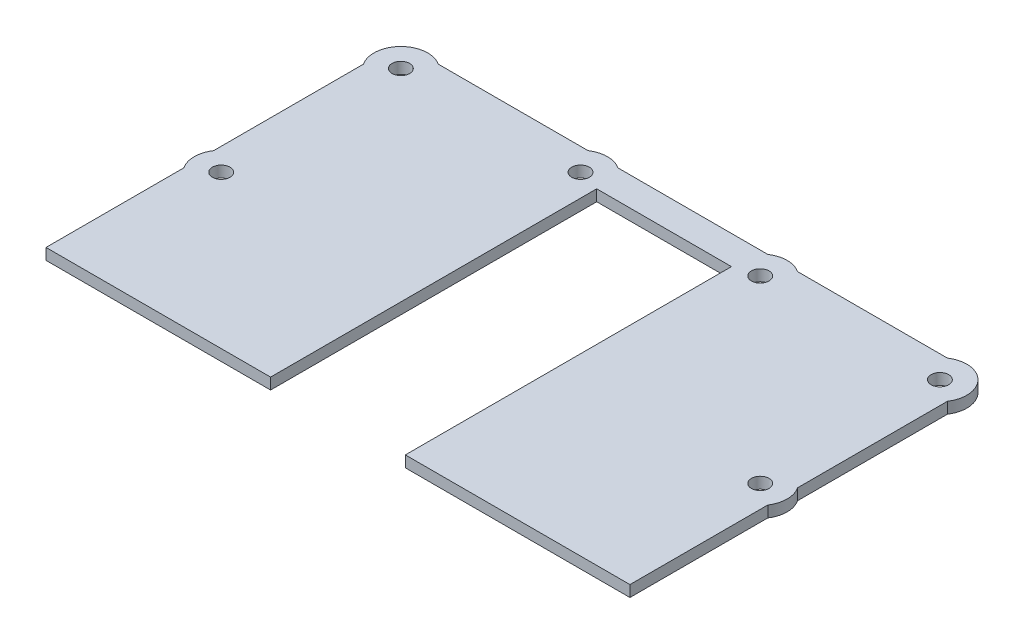
from build123d import *

# Parameters (mm, degrees)
SKETCH1_R           = 2.4892
BOSS_EXTRUDE1_DEPTH = 3.175
SKETCH2_W           = 165.1
SKETCH2_H           = 13.97
CUT_EXTRUDE1_DEPTH  = 203.596847026


with BuildPart() as part:
    # Sketch1 → Boss-Extrude1 (new body)
    with BuildSketch(Plane(origin=(0, 0, 0), x_dir=(1, 0, 0), z_dir=(0, 1, 0))):
        with BuildLine():
            Line((-61.362113484, 114.3), (-103.737886516, 114.3))
            ThreePointArc((-103.737886516, 114.3), (-107.95, 115.57), (-112.162113484, 114.3))
            Line((-112.162113484, 114.3), (-154.537886516, 114.3))
            ThreePointArc((-154.537886516, 114.3), (-164.138153673, 113.338153673), (-165.1, 103.737886516))
            Line((-165.1, 103.737886516), (-165.1, 61.362113484))
            ThreePointArc((-165.1, 61.362113484), (-166.37, 57.15), (-165.1, 52.937886516))
            Line((-165.1, 52.937886516), (-165.1, 0))
            Line((-165.1, 0), (-101.6, 0))
            Line((-101.6, 0), (-101.6, 106.172))
            Line((-101.6, 106.172), (-63.5, 106.172))
            Line((-63.5, 106.172), (-63.5, 0))
            Line((-63.5, 0), (0, 0))
            Line((0, 0), (0, 52.937886516))
            ThreePointArc((0, 52.937886516), (1.27, 57.15), (0, 61.362113484))
            Line((0, 61.362113484), (0, 103.737886516))
            ThreePointArc((0, 103.737886516), (-0.961846327, 113.338153673), (-10.562113484, 114.3))
            Line((-10.562113484, 114.3), (-52.937886516, 114.3))
            ThreePointArc((-52.937886516, 114.3), (-57.15, 115.57), (-61.362113484, 114.3))
        make_face()
        with Locations((-158.75, 57.15)):
            Circle(SKETCH1_R, mode=Mode.SUBTRACT)
        with Locations((-6.35, 57.15)):
            Circle(SKETCH1_R, mode=Mode.SUBTRACT)
        with Locations((-158.75, 107.95)):
            Circle(SKETCH1_R, mode=Mode.SUBTRACT)
        with Locations((-107.95, 107.95)):
            Circle(SKETCH1_R, mode=Mode.SUBTRACT)
        with Locations((-57.15, 107.95)):
            Circle(SKETCH1_R, mode=Mode.SUBTRACT)
        with Locations((-6.35, 107.95)):
            Circle(SKETCH1_R, mode=Mode.SUBTRACT)
    extrude(amount=BOSS_EXTRUDE1_DEPTH)

    # Sketch2 → Cut-Extrude1 (cut, through all)
    with BuildSketch(Plane(origin=(0, 3.175, 0), x_dir=(1, 0, 0), z_dir=(0, 1, 0))):
        with Locations((-82.55, 6.985)):
            Rectangle(SKETCH2_W, SKETCH2_H)
    extrude(amount=-CUT_EXTRUDE1_DEPTH, mode=Mode.SUBTRACT)


solid = part.part
